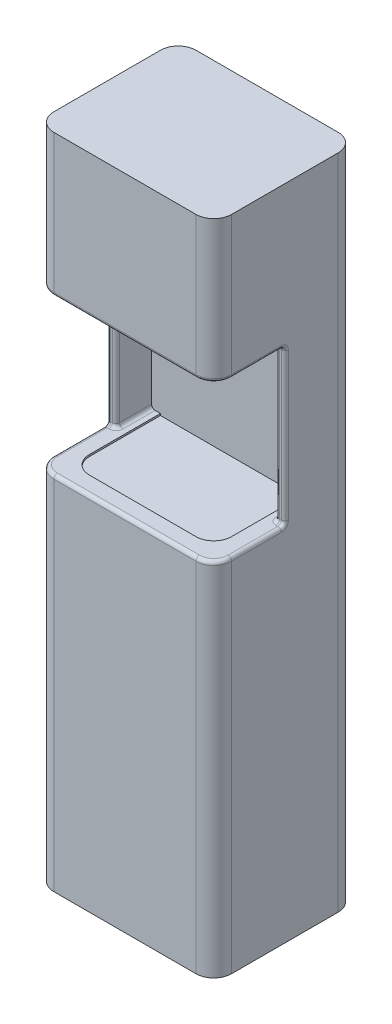
from build123d import *

# Parameters (mm, degrees)
BOSS_EXTRUDE1_DEPTH = 1000
SHELL1_T            = -15
BOSS_EXTRUDE2_DEPTH = 10
BOSS_EXTRUDE3_DEPTH = 15
BOSS_EXTRUDE4_DEPTH = 450
BOSS_EXTRUDE7_DEPTH = 450
BOSS_EXTRUDE8_DEPTH = 400
FILLET3_R           = 10


# Read off the part's stored shape, not the designer's step: Boss-Extrude3
with BuildPart() as part:
    # Sketch1 → Boss-Extrude1 (new body)
    with BuildSketch(Plane(origin=(0, 0, 0), x_dir=(1, 0, 0), z_dir=(0, 1, 0))):
        with BuildLine():
            Line((-200, -200), (200, -200))
            ThreePointArc((200, -200), (235.355339059, -185.355339059), (250, -150))
            Line((250, -150), (250, 150))
            ThreePointArc((250, 150), (235.355339059, 185.355339059), (200, 200))
            Line((200, 200), (-200, 200))
            ThreePointArc((-200, 200), (-235.355339059, 185.355339059), (-250, 150))
            Line((-250, 150), (-250, -150))
            ThreePointArc((-250, -150), (-235.355339059, -185.355339059), (-200, -200))
        make_face()
    extrude(amount=BOSS_EXTRUDE1_DEPTH)

    # Shell1
    shell1_openings = [part.faces().sort_by_distance(p)[0] for p in [
        (0, 1000, 0),
    ]]
    offset(amount=SHELL1_T, openings=shell1_openings, kind=Kind.INTERSECTION)

    # Sketch3 → Boss-Extrude2 (add)
    with BuildSketch(Plane(origin=(0, 1000, 0), x_dir=(1, 0, 0), z_dir=(0, 1, 0))):
        with BuildLine():
            Line((200, 0), (200, 100))
            Line((200, 100), (-200, 100))
            Line((-200, 100), (-200, 0))
            Line((-200, 0), (-250, 0))
            Line((-250, 0), (-250, -150))
            ThreePointArc((-250, -150), (-235.355339059, -185.355339059), (-200, -200))
            Line((-200, -200), (200, -200))
            ThreePointArc((200, -200), (235.355339059, -185.355339059), (250, -150))
            Line((250, -150), (250, 0))
            Line((250, 0), (200, 0))
        make_face()
    extrude(amount=BOSS_EXTRUDE2_DEPTH)

    # Boss-Extrude3 outline → Boss-Extrude3 (add)
    with BuildSketch(Plane(origin=(0, 1000, 0), x_dir=(1, 0, 0), z_dir=(0, 1, 0))):
        with BuildLine():
            Line((200, 100), (200, -100))
            ThreePointArc((200, -100), (185.355339059, -135.355339059), (150, -150))
            Line((150, -150), (-150, -150))
            ThreePointArc((-150, -150), (-185.355339059, -135.355339059), (-200, -100))
            Line((-200, -100), (-200, 100))
            ThreePointArc((-200, 100), (-199.74680765, 105.0254481), (-198.989794856, 110))
            Line((-198.989794856, 110), (-225, 110))
            Line((-225, 110), (-225, 0))
            Line((-225, 0), (-250, 0))
            Line((-250, 0), (-250, -150))
            ThreePointArc((-250, -150), (-235.355339059, -185.355339059), (-200, -200))
            Line((-200, -200), (200, -200))
            ThreePointArc((200, -200), (235.355339059, -185.355339059), (250, -150))
            Line((250, -150), (250, 0))
            Line((250, 0), (225, 0))
            Line((225, 0), (225, 110))
            Line((225, 110), (198.989794856, 110))
            ThreePointArc((198.989794856, 110), (199.74680765, 105.0254481), (200, 100))
        make_face()
    extrude(amount=BOSS_EXTRUDE3_DEPTH)

    # Sketch3<5> → Boss-Extrude4 (add)
    with BuildSketch(Plane(origin=(0, 1000, 0), x_dir=(1, 0, 0), z_dir=(0, 1, 0))):
        with BuildLine():
            Line((-250, 0), (-225, 0))
            Line((-225, 0), (-225, 100))
            Line((-225, 100), (-225, 110))
            Line((-225, 110), (-225, 125))
            ThreePointArc((-225, 125), (-210.355339059, 160.355339059), (-175, 175))
            Line((-175, 175), (175, 175))
            ThreePointArc((175, 175), (210.355339059, 160.355339059), (225, 125))
            Line((225, 125), (225, 110))
            Line((225, 110), (225, 100))
            Line((225, 100), (225, 0))
            Line((225, 0), (250, 0))
            Line((250, 0), (250, 150))
            ThreePointArc((250, 150), (235.355339059, 185.355339059), (200, 200))
            Line((200, 200), (-200, 200))
            ThreePointArc((-200, 200), (-235.355339059, 185.355339059), (-250, 150))
            Line((-250, 150), (-250, 0))
        make_face()
    extrude(amount=BOSS_EXTRUDE4_DEPTH)

    # Sketch3<7> → Boss-Extrude7 (add)
    with BuildSketch(Plane(origin=(0, 1000, 0), x_dir=(1, 0, 0), z_dir=(0, 1, 0))):
        with BuildLine():
            ThreePointArc((-198.989794856, 110), (-199.74680765, 105.0254481), (-200, 100))
            Line((-200, 100), (200, 100))
            ThreePointArc((200, 100), (199.74680765, 105.0254481), (198.989794856, 110))
            Line((198.989794856, 110), (-198.989794856, 110))
        make_face()
        with BuildLine():
            ThreePointArc((198.989794856, 110), (199.74680765, 105.0254481), (200, 100))
            Line((200, 100), (225, 100))
            Line((225, 100), (225, 110))
            Line((225, 110), (198.989794856, 110))
        make_face()
        with BuildLine():
            Line((-225, 100), (-200, 100))
            ThreePointArc((-200, 100), (-199.74680765, 105.0254481), (-198.989794856, 110))
            Line((-198.989794856, 110), (-225, 110))
            Line((-225, 110), (-225, 100))
        make_face()
    extrude(amount=BOSS_EXTRUDE7_DEPTH)

    # Sketch5 → Boss-Extrude8 (add)
    with BuildSketch(Plane(origin=(0, 1450, 0), x_dir=(1, 0, 0), z_dir=(0, 1, 0))):
        with BuildLine():
            Line((-200, -200), (200, -200))
            ThreePointArc((200, -200), (235.355339059, -185.355339059), (250, -150))
            Line((250, -150), (250, 150))
            ThreePointArc((250, 150), (235.355339059, 185.355339059), (200, 200))
            Line((200, 200), (-200, 200))
            ThreePointArc((-200, 200), (-235.355339059, 185.355339059), (-250, 150))
            Line((-250, 150), (-250, -150))
            ThreePointArc((-250, -150), (-235.355339059, -185.355339059), (-200, -200))
        make_face()
    extrude(amount=BOSS_EXTRUDE8_DEPTH)

    # Fillet3
    fillet3_edges = [part.edges().sort_by_distance(p)[0] for p in [
        (-225, 1232.5, 0),
        (225, 1450, -50),
        (237.5, 1450, 0),
        (225, 1232.5, 0),
        (-237.5, 1450, 0),
        (-250, 1232.5, 0),
        (250, 1232.5, 0),
        (-225, 1450, -50),
        (0, 1450, -100),
        (-235.355339059, 1450, 185.355339059),
        (0, 1450, 200),
        (235.355339059, 1450, 185.355339059),
        (250, 1450, 75),
        (-250, 1450, 75),
        (-237.5, 1015, 0),
        (0, 1015, 200),
        (250, 1015, 75),
        (237.5, 1015, 0),
        (225, 1015, -50),
        (235.355339059, 1015, 185.355339059),
        (-250, 1015, 75),
        (-235.355339059, 1015, 185.355339059),
        (-225, 1015, -50),
    ]]
    fillet(fillet3_edges, radius=FILLET3_R)


solid = part.part
